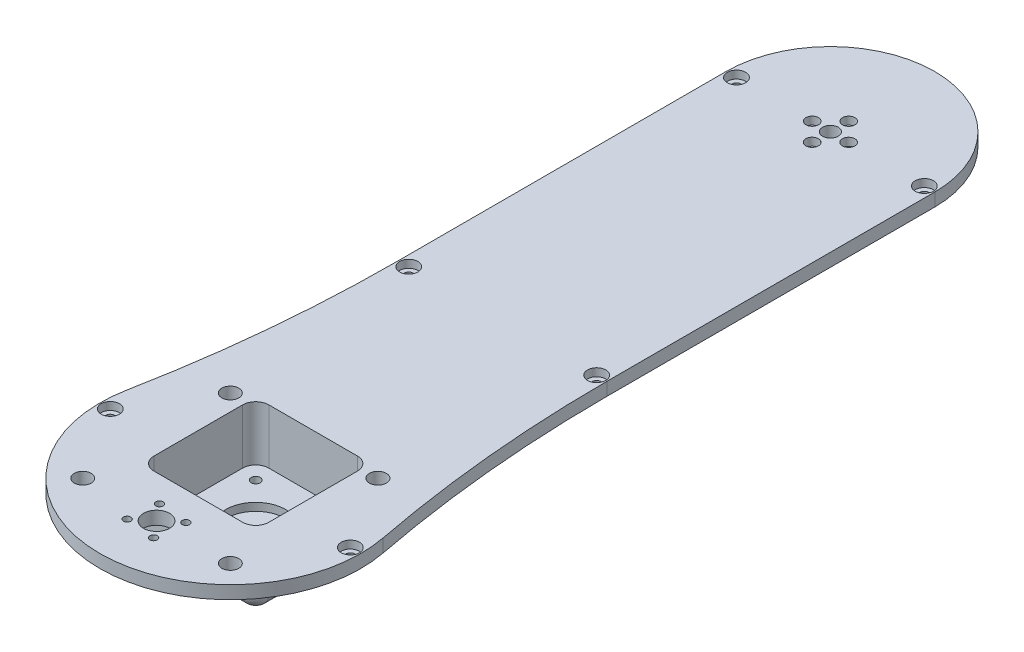
from build123d import *

# Parameters (mm, degrees)
EXTRUDE_1_DEPTH      = 5
SKETCH_2_R           = 3.25
CUT_EXTRUDE_1_DEPTH  = 5
SKETCH_3_R           = 5
CUT_EXTRUDE_2_DEPTH  = 5
SKETCH_4_R           = 1.4
CUT_EXTRUDE_3_DEPTH  = 5
SKETCH_10_R          = 1.75
CUT_EXTRUDE_8_DEPTH  = 45
SKETCH_11_R          = 3.5
CUT_EXTRUDE_9_DEPTH  = 3
SKETCH_12_W          = 44
SKETCH_12_H          = 44
CUT_EXTRUDE_10_DEPTH = 10
SKETCH_13_W          = 44
SKETCH_13_H          = 44
EXTRUDE_2_DEPTH      = 16
EXTRUDE_3_DEPTH      = 4
FILLET_1_R           = 5
SKETCH_16_R          = 11.5
CUT_EXTRUDE_11_DEPTH = 3
SKETCH_17_R          = 3
CUT_EXTRUDE_12_DEPTH = 3
FILLET_2_R           = 5
SKETCH_18_R          = 1.75
CUT_EXTRUDE_13_DEPTH = 18
SKETCH_20_R          = 3
CUT_EXTRUDE_14_DEPTH = 39
EXTRUDE_START        = 20
SKETCH_21_R          = 4.5
SKETCH_21_R_2        = 3
EXTRUDE_4_DEPTH      = 20
CHAMFER_1_SIZE       = 10
CHAMFER_1_SIZE2      = 17.320508076
SKETCH_22_R          = 2.4
CUT_EXTRUDE_16_DEPTH = 3


with BuildPart() as part:
    # 草图1 → 凸台-拉伸1 (new body)
    with BuildSketch(Plane(origin=(0, 0, 0), x_dir=(1, 0, 0), z_dir=(0, 1, 0))):
        with BuildLine():
            Line((-40, 104.403065089), (-40, 230))
            ThreePointArc((-40, 230), (0, 270), (40, 230))
            Line((40, 230), (40, 104.403065089))
            ThreePointArc((40, 104.403065089), (42.277916175, 56.729935627), (49.090909091, 9.491187735))
            ThreePointArc((49.090909091, 9.491187735), (0, -50), (-49.090909091, 9.491187735))
            ThreePointArc((-49.090909091, 9.491187735), (-42.277916175, 56.729935627), (-40, 104.403065089))
        make_face()
    extrude(amount=EXTRUDE_1_DEPTH)

    # 草图2 → 切除-拉伸1 (cut)
    with BuildSketch(Plane(origin=(0, 5, 0), x_dir=(1, 0, 0), z_dir=(0, 1, 0))):
        with Locations((28.284271247, 28.284271247)):
            Circle(SKETCH_2_R)
        with Locations((28.284271247, -28.284271247)):
            Circle(SKETCH_2_R)
        with Locations((-28.284271247, -28.284271247)):
            Circle(SKETCH_2_R)
        with Locations((-28.284271247, 28.284271247)):
            Circle(SKETCH_2_R)
    extrude(amount=-CUT_EXTRUDE_1_DEPTH, mode=Mode.SUBTRACT)

    # 草图3 → 切除-拉伸2 (cut)
    with BuildSketch(Plane(origin=(0, 5, 0), x_dir=(1, 0, 0), z_dir=(0, 1, 0))):
        with Locations((0, -28.284271247)):
            Circle(SKETCH_3_R)
    extrude(amount=-CUT_EXTRUDE_2_DEPTH, mode=Mode.SUBTRACT)

    # 草图4 → 切除-拉伸3 (cut)
    with BuildSketch(Plane.XZ):
        with Locations((5.068555992, 34.473757507)):
            Circle(SKETCH_4_R)
        with Locations((6.189486259, 23.215715255)):
            Circle(SKETCH_4_R)
        with Locations((-5.068555992, 22.094784988)):
            Circle(SKETCH_4_R)
        with Locations((-6.189486259, 33.35282724)):
            Circle(SKETCH_4_R)
    extrude(amount=-CUT_EXTRUDE_3_DEPTH, mode=Mode.SUBTRACT)

    # 草图10 → 切除-拉伸8 (cut)
    with BuildSketch(Plane.XZ):
        with Locations((46, 0)):
            Circle(SKETCH_10_R)
        with Locations((36, -104.403065089)):
            Circle(SKETCH_10_R)
        with Locations((36, -230)):
            Circle(SKETCH_10_R)
        with Locations((-36, -230)):
            Circle(SKETCH_10_R)
        with Locations((-36, -104.403065089)):
            Circle(SKETCH_10_R)
        with Locations((-46, 0)):
            Circle(SKETCH_10_R)
    extrude(amount=-CUT_EXTRUDE_8_DEPTH, mode=Mode.SUBTRACT)

    # 草图11 → 切除-拉伸9 (cut)
    with BuildSketch(Plane(origin=(0, 5, 0), x_dir=(1, 0, 0), z_dir=(0, 1, 0))):
        with Locations((-36, 230)):
            Circle(SKETCH_11_R)
        with Locations((-36, 104.403065089)):
            Circle(SKETCH_11_R)
        with Locations((-46, 0)):
            Circle(SKETCH_11_R)
        with Locations((46, 0)):
            Circle(SKETCH_11_R)
        with Locations((36, 104.403065089)):
            Circle(SKETCH_11_R)
        with Locations((36, 230)):
            Circle(SKETCH_11_R)
    extrude(amount=-CUT_EXTRUDE_9_DEPTH, mode=Mode.SUBTRACT)

    # 草图12 → 切除-拉伸10 (cut)
    with BuildSketch(Plane(origin=(0, 5, 0), x_dir=(1, 0, 0), z_dir=(0, 1, 0))):
        with Locations((0, 9.735724541)):
            Rectangle(SKETCH_12_W, SKETCH_12_H)
    extrude(amount=-CUT_EXTRUDE_10_DEPTH, mode=Mode.SUBTRACT)

    # 草图13 → 凸台-拉伸2 (add)
    with BuildSketch(Plane.XZ):
        with BuildLine():
            Line((-21, 16.264275459), (21, 16.264275459))
            ThreePointArc((21, 16.264275459), (24.535533906, 14.799809365), (26, 11.264275459))
            Line((26, 11.264275459), (26, -30.735724541))
            ThreePointArc((26, -30.735724541), (24.535533906, -34.271258447), (21, -35.735724541))
            Line((21, -35.735724541), (-21, -35.735724541))
            ThreePointArc((-21, -35.735724541), (-24.535533906, -34.271258447), (-26, -30.735724541))
            Line((-26, -30.735724541), (-26, 11.264275459))
            ThreePointArc((-26, 11.264275459), (-24.535533906, 14.799809365), (-21, 16.264275459))
        make_face()
        with Locations((0, -9.735724541)):
            Rectangle(SKETCH_13_W, SKETCH_13_H, mode=Mode.SUBTRACT)
    extrude(amount=EXTRUDE_2_DEPTH)

    # 草图15 → 凸台-拉伸3 (add)
    with BuildSketch(Plane.XZ.offset(16)):
        with BuildLine():
            Line((26, -30.735724541), (26, 11.264275459))
            ThreePointArc((26, 11.264275459), (24.535533906, 14.799809365), (21, 16.264275459))
            Line((21, 16.264275459), (-21, 16.264275459))
            ThreePointArc((-21, 16.264275459), (-24.535533906, 14.799809365), (-26, 11.264275459))
            Line((-26, 11.264275459), (-26, -30.735724541))
            ThreePointArc((-26, -30.735724541), (-24.535533906, -34.271258447), (-21, -35.735724541))
            Line((-21, -35.735724541), (21, -35.735724541))
            ThreePointArc((21, -35.735724541), (24.535533906, -34.271258447), (26, -30.735724541))
        make_face()
    extrude(amount=EXTRUDE_3_DEPTH)

    # 圆角1
    fillet_1_edges = [part.edges().sort_by_distance(p)[0] for p in [
        (26, -20, -9.735724541),
        (24.535533906, -20, -34.271258447),
        (0, -20, -35.735724541),
        (-24.535533906, -20, -34.271258447),
        (-26, -20, -9.735724541),
        (-24.535533906, -20, 14.799809365),
        (0, -20, 16.264275459),
        (24.535533906, -20, 14.799809365),
    ]]
    fillet(fillet_1_edges, radius=FILLET_1_R)

    # 草图16 → 切除-拉伸11 (cut)
    with BuildSketch(Plane(origin=(0, -16, 0), x_dir=(1, 0, 0), z_dir=(0, 1, 0))):
        with Locations((0, 9.735724541)):
            Circle(SKETCH_16_R)
    extrude(amount=-CUT_EXTRUDE_11_DEPTH, mode=Mode.SUBTRACT)

    # 草图17 → 切除-拉伸12 (cut)
    with BuildSketch(Plane(origin=(0, -19, 0), x_dir=(1, 0, 0), z_dir=(0, 1, 0))):
        with Locations((0, 9.735724541)):
            Circle(SKETCH_17_R)
    extrude(amount=-CUT_EXTRUDE_12_DEPTH, mode=Mode.SUBTRACT)

    # 圆角2
    fillet_2_edges = [part.edges().sort_by_distance(p)[0] for p in [
        (22, -5.5, 12.264275459),
        (-22, -5.5, 12.264275459),
        (-22, -5.5, -31.735724541),
        (22, -5.5, -31.735724541),
    ]]
    fillet(fillet_2_edges, radius=FILLET_2_R)

    # 草图18 → 切除-拉伸13 (cut)
    with BuildSketch(Plane(origin=(0, -16, 0), x_dir=(1, 0, 0), z_dir=(0, 1, 0))):
        with Locations((-15.494, 25.229724541)):
            Circle(SKETCH_18_R)
        with Locations((15.494, 25.229724541)):
            Circle(SKETCH_18_R)
        with Locations((15.494, -5.758275459)):
            Circle(SKETCH_18_R)
        with Locations((-15.494, -5.758275459)):
            Circle(SKETCH_18_R)
    extrude(amount=-CUT_EXTRUDE_13_DEPTH, mode=Mode.SUBTRACT)

    # 草图20 → 切除-拉伸14 (cut)
    with BuildSketch(Plane.XZ):
        with Locations((0, -230)):
            Circle(SKETCH_20_R)
    extrude(amount=-CUT_EXTRUDE_14_DEPTH, mode=Mode.SUBTRACT)

    # 草图21 → 凸台-拉伸4 (add)
    with BuildSketch(Plane.XZ.offset(EXTRUDE_START)):
        with Locations((0, -230)):
            Circle(SKETCH_21_R)
        with Locations((0, -230)):
            Circle(SKETCH_21_R_2, mode=Mode.SUBTRACT)
    extrude(amount=-EXTRUDE_4_DEPTH)

    # 倒角1
    chamfer_1_edges = [part.edges().sort_by_distance(p)[0] for p in [
        (-4.5, 0, -230),
    ]]
    chamfer_1_side = [part.faces().sort_by_distance(p)[0] for p in [
        (0, 0, -116.521330916),
    ]]
    chamfer(chamfer_1_edges, length=CHAMFER_1_SIZE, length2=CHAMFER_1_SIZE2, reference=chamfer_1_side[0])

    # 草图22 → 切除-拉伸16 (cut)
    with BuildSketch(Plane(origin=(0, 5, 0), x_dir=(1, 0, 0), z_dir=(0, 1, 0))):
        with Locations((7, 229.983152386)):
            Circle(SKETCH_22_R)
        with Locations((-0.016847614, 223)):
            Circle(SKETCH_22_R)
        with Locations((-7, 230.016847614)):
            Circle(SKETCH_22_R)
        with Locations((0.016847614, 237)):
            Circle(SKETCH_22_R)
    extrude(amount=-CUT_EXTRUDE_16_DEPTH, mode=Mode.SUBTRACT)


solid = part.part
